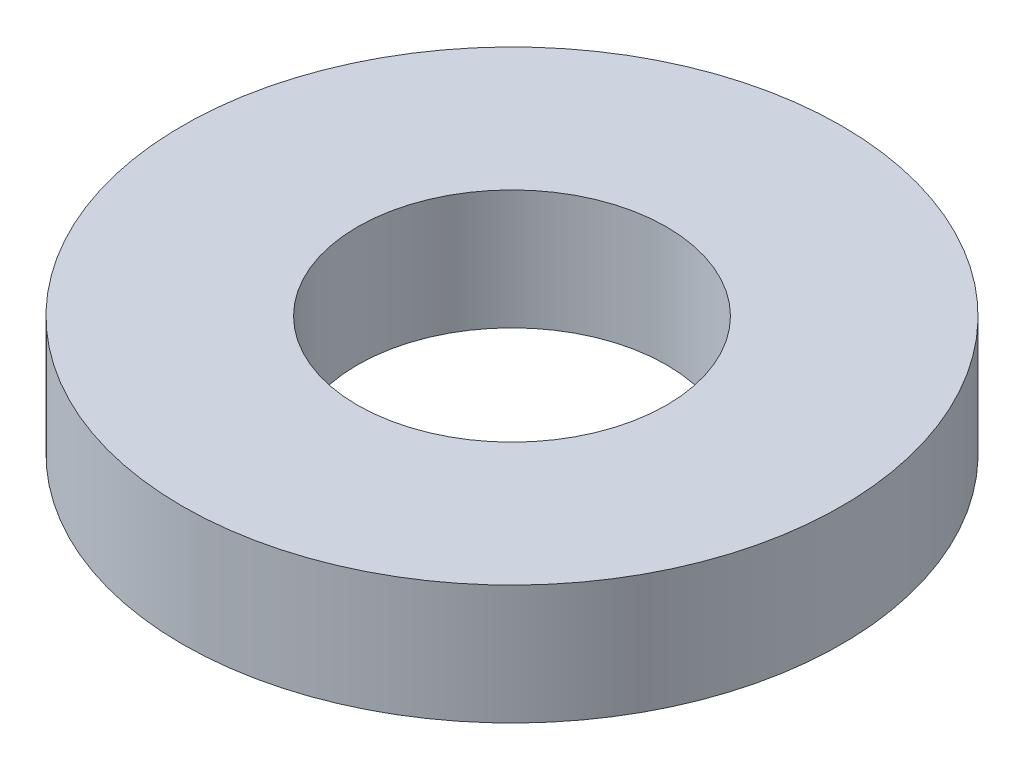
from build123d import *

# Parameters (mm, degrees)
SKETCH1_R           = 80
BOSS_EXTRUDE1_DEPTH = 29
SKETCH2_R           = 37.5
CUT_EXTRUDE1_DEPTH  = 117.79469166


with BuildPart() as part:
    # Sketch1 → Boss-Extrude1 (new body)
    with BuildSketch(Plane(origin=(0, 0, 0), x_dir=(1, 0, 0), z_dir=(0, 1, 0))):
        Circle(SKETCH1_R)
    extrude(amount=BOSS_EXTRUDE1_DEPTH)

    # Sketch2 → Cut-Extrude1 (cut, through all)
    with BuildSketch(Plane(origin=(0, 0, 0), x_dir=(1, 0, 0), z_dir=(0, 1, 0))):
        Circle(SKETCH2_R)
    extrude(amount=CUT_EXTRUDE1_DEPTH, mode=Mode.SUBTRACT)


solid = part.part
